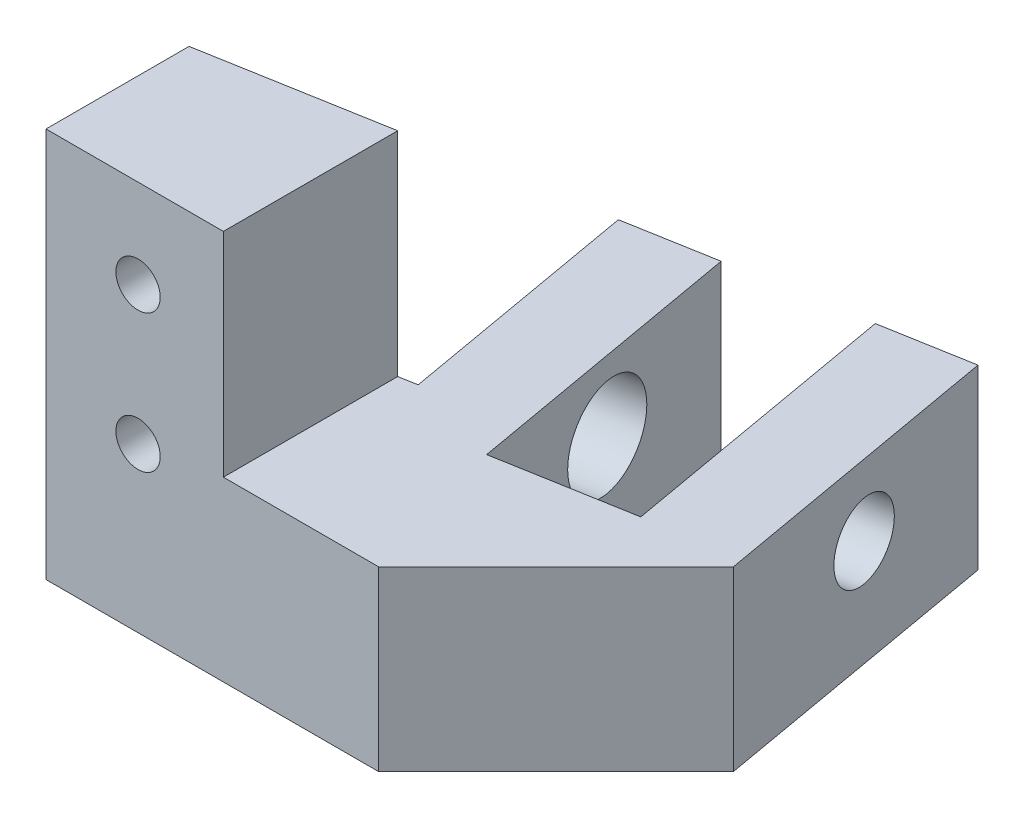
from build123d import *

# Parameters (mm, degrees)
BOSS_EXTRU_1_DEPTH      = 10
BOSS_EXTRU_2_DEPTH      = 10
ENL_V_MAT_EXTRU_1_REACH = 37.367
ENL_V_MAT_EXTRU_2_REACH = 34.134
ESQUISSE4_R             = 2.75
ENL_V_MAT_EXTRU_3_REACH = 36.763
ESQUISSE5_R             = 2.1
CHANFREIN1_SIZE         = 10
ENL_V_MAT_EXTRU_4_REACH = 41.885
ENL_V_MAT_EXTRU_5_REACH = 47.008
ESQUISSE7_R             = 1.25


with BuildPart() as part:
    # Esquisse1 → Boss.-Extru.1 (new body)
    with BuildSketch(Plane.XY):
        Polygon((0, 0), (28.75, 0), (28.75, 10), (10, 10), (10, 22), (0, 22), align=None)
    extrude(amount=BOSS_EXTRU_1_DEPTH)

    # Esquisse2 → Boss.-Extru.2 (add)
    with BuildSketch(Plane(origin=(0, 10, 0), x_dir=(1, 0, 0), z_dir=(0, 1, 0))):
        Polygon((28.75, 0), (25.79798098, 16.741731801), (20.873942215, 15.873490913), (23.672866941, 0), align=None)
        Polygon((16.057167351, 0), (13.487884067, 14.57112958), (8.563845302, 13.702888692), (10.980034292, 0), align=None)
    extrude(amount=-BOSS_EXTRU_2_DEPTH)

    # Esquisse3 → Enlèv. mat.-Extru.1 (cut, up to next)
    with BuildSketch(Plane(origin=(0, 10, 0), x_dir=(1, 0, 0), z_dir=(0, 1, 0)), mode=Mode.PRIVATE) as enl_v_mat_extru_1_sk1:
        Polygon((16.057167351, 0), (16.317639618, -1.47721163), (23.703697766, -0.174850297), (23.672866941, 0), align=None)
    enl_v_mat_extru_1_tool1 = extrude(enl_v_mat_extru_1_sk1.sketch, amount=-ENL_V_MAT_EXTRU_1_REACH, mode=Mode.PRIVATE) & part.part
    add(enl_v_mat_extru_1_tool1.solids().sort_by_distance((18.952321, 10, 0.498572))[0], mode=Mode.SUBTRACT)

    # Esquisse4 → Enlèv. mat.-Extru.2 (cut, up to next)
    with BuildSketch(Plane(origin=(10.648945746, 0, -1.877696451), x_dir=(0.1736481776669311, 0, 0.9848077530122079), z_dir=(-0.9848077530122079, 0, 0.1736481776669311)), mode=Mode.PRIVATE) as enl_v_mat_extru_2_sk1:
        with Locations((-4.093337054, 6)):
            Circle(ESQUISSE4_R)
    enl_v_mat_extru_2_tool1 = extrude(enl_v_mat_extru_2_sk1.sketch, amount=-ENL_V_MAT_EXTRU_2_REACH, mode=Mode.PRIVATE) & part.part
    add(enl_v_mat_extru_2_tool1.solids().sort_by_distance((9.938145, 6, -5.908847))[0], mode=Mode.SUBTRACT)

    # Esquisse5 → Enlèv. mat.-Extru.3 (cut, up to next)
    with BuildSketch(Plane(origin=(22.959042659, 0, -4.048298672), x_dir=(0.1736481776669306, 0, 0.9848077530122081), z_dir=(-0.9848077530122081, 0, 0.1736481776669306)), mode=Mode.PRIVATE) as enl_v_mat_extru_3_sk1:
        with Locations((-4.093337054, 6)):
            Circle(ESQUISSE5_R)
    enl_v_mat_extru_3_tool1 = extrude(enl_v_mat_extru_3_sk1.sketch, amount=-ENL_V_MAT_EXTRU_3_REACH, mode=Mode.PRIVATE) & part.part
    add(enl_v_mat_extru_3_tool1.solids().sort_by_distance((22.248242, 6, -8.079449))[0], mode=Mode.SUBTRACT)

    # Chanfrein1
    chanfrein1_edges = [part.edges().sort_by_distance(p)[0] for p in [
        (28.75, 5, 10),
    ]]
    chamfer(chanfrein1_edges, length=CHANFREIN1_SIZE - 0.0001)  # a hair under: the kernel refuses the full size

    # Esquisse6 → Enlèv. mat.-Extru.4 (cut, up to next)
    with BuildSketch(Plane(origin=(0, 22, 0), x_dir=(1, 0, 0), z_dir=(0, 1, 0)), mode=Mode.PRIVATE) as enl_v_mat_extru_4_sk1:
        Polygon((0, 0), (10.980034292, 0), (0, -1.936076295), align=None)
    enl_v_mat_extru_4_tool1 = extrude(enl_v_mat_extru_4_sk1.sketch, amount=-ENL_V_MAT_EXTRU_4_REACH, mode=Mode.PRIVATE) & part.part
    add(enl_v_mat_extru_4_tool1.solids().sort_by_distance((3.660011, 22, 0.645359))[0], mode=Mode.SUBTRACT)

    # Enlèv. mat.-Extru.5: up to this plane
    enl_v_mat_extru_5_end = Plane(origin=(10.980034292, -0.001, 0), z_dir=(0.17364817766693136, 0, 0.9848077530122079))
    # Esquisse7 → Enlèv. mat.-Extru.5 (cut, up to the surface)
    with BuildSketch(Plane.XY.offset(10), mode=Mode.PRIVATE) as enl_v_mat_extru_5_sk1:
        with Locations((5.19, 17)):
            Circle(ESQUISSE7_R)
    enl_v_mat_extru_5_tool1 = split(extrude(enl_v_mat_extru_5_sk1.sketch, amount=-ENL_V_MAT_EXTRU_5_REACH, mode=Mode.PRIVATE), bisect_by=enl_v_mat_extru_5_end, keep=Keep.BOTH, mode=Mode.PRIVATE)
    add(enl_v_mat_extru_5_tool1.solids().sort_by_distance((5.19, 17, 10))[0], mode=Mode.SUBTRACT)
    # Esquisse7 → Enlèv. mat.-Extru.5 (cut, up to the surface)
    with BuildSketch(Plane.XY.offset(10), mode=Mode.PRIVATE) as enl_v_mat_extru_5_sk2:
        with Locations((5.19, 9.22)):
            Circle(ESQUISSE7_R)
    enl_v_mat_extru_5_tool2 = split(extrude(enl_v_mat_extru_5_sk2.sketch, amount=-ENL_V_MAT_EXTRU_5_REACH, mode=Mode.PRIVATE), bisect_by=enl_v_mat_extru_5_end, keep=Keep.BOTH, mode=Mode.PRIVATE)
    add(enl_v_mat_extru_5_tool2.solids().sort_by_distance((5.19, 9.22, 10))[0], mode=Mode.SUBTRACT)


solid = part.part
